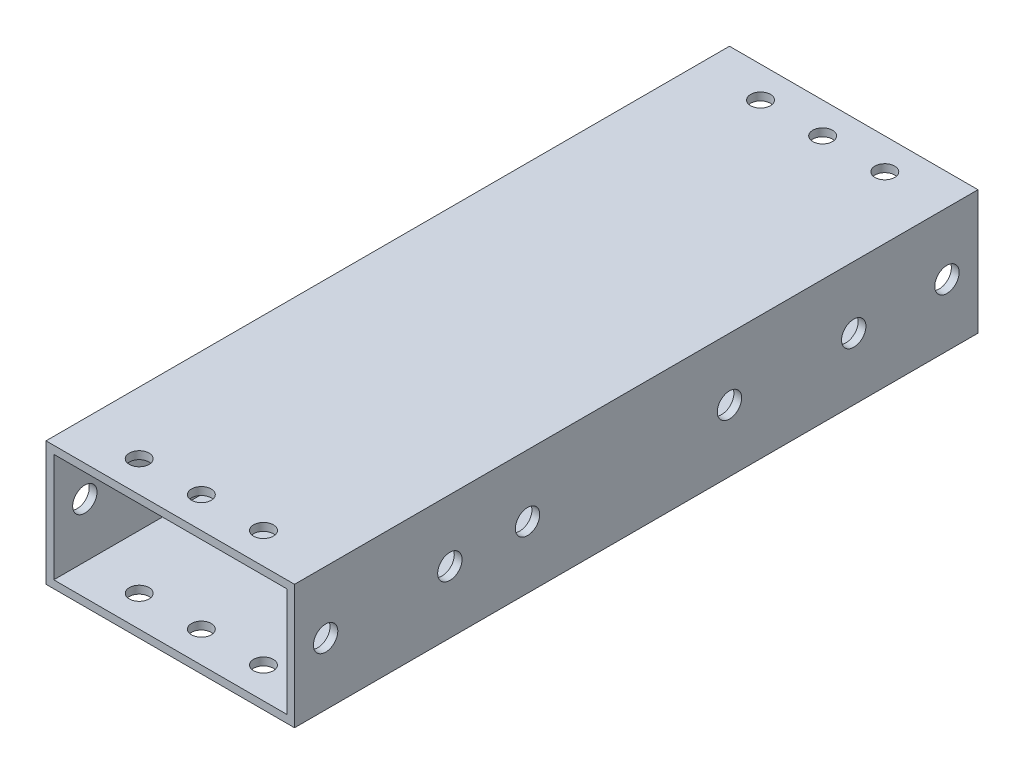
from build123d import *

# Parameters (mm, degrees)
SKETCH1_W           = 50.8
SKETCH1_H           = 25.4
SKETCH1_W_2         = 47.625
SKETCH1_H_2         = 22.225
BOSS_EXTRUDE1_DEPTH = 69.85
SKETCH2_R           = 2.0193
CUT_EXTRUDE1_DEPTH  = 79.545162168
SKETCH3_R           = 2.4892
CUT_EXTRUDE2_DEPTH  = 88.298066989


with BuildPart() as part:
    # Sketch1 → Boss-Extrude1 (new, symmetric)
    with BuildSketch(Plane.XY):
        Rectangle(SKETCH1_W, SKETCH1_H)
        Rectangle(SKETCH1_W_2, SKETCH1_H_2, mode=Mode.SUBTRACT)
    extrude(amount=BOSS_EXTRUDE1_DEPTH, both=True)

    # Sketch2 → Cut-Extrude1 (cut, through all)
    with BuildSketch(Plane(origin=(0, 12.7, 0), x_dir=(1, 0, 0), z_dir=(0, 1, 0))):
        with Locations((-12.7, 63.5)):
            Circle(SKETCH2_R)
        with Locations((0, 63.5)):
            Circle(SKETCH2_R)
        with Locations((12.7, 63.5)):
            Circle(SKETCH2_R)
        with Locations((12.7, -63.5)):
            Circle(SKETCH2_R)
        with Locations((0, -63.5)):
            Circle(SKETCH2_R)
        with Locations((-12.7, -63.5)):
            Circle(SKETCH2_R)
    extrude(amount=-CUT_EXTRUDE1_DEPTH, mode=Mode.SUBTRACT)

    # Sketch3 → Cut-Extrude2 (cut, through all)
    with BuildSketch(Plane(origin=(25.4, 0, 0), x_dir=(0, 0, -1), z_dir=(1, 0, 0))):
        with Locations((63.5, 0)):
            Circle(SKETCH3_R)
        with Locations((44.45, 0)):
            Circle(SKETCH3_R)
        with Locations((19.05, 0)):
            Circle(SKETCH3_R)
        with Locations((-63.5, 0)):
            Circle(SKETCH3_R)
        with Locations((-38.1, 0)):
            Circle(SKETCH3_R)
        with Locations((-22.225, 0)):
            Circle(SKETCH3_R)
    extrude(amount=-CUT_EXTRUDE2_DEPTH, mode=Mode.SUBTRACT)


solid = part.part
